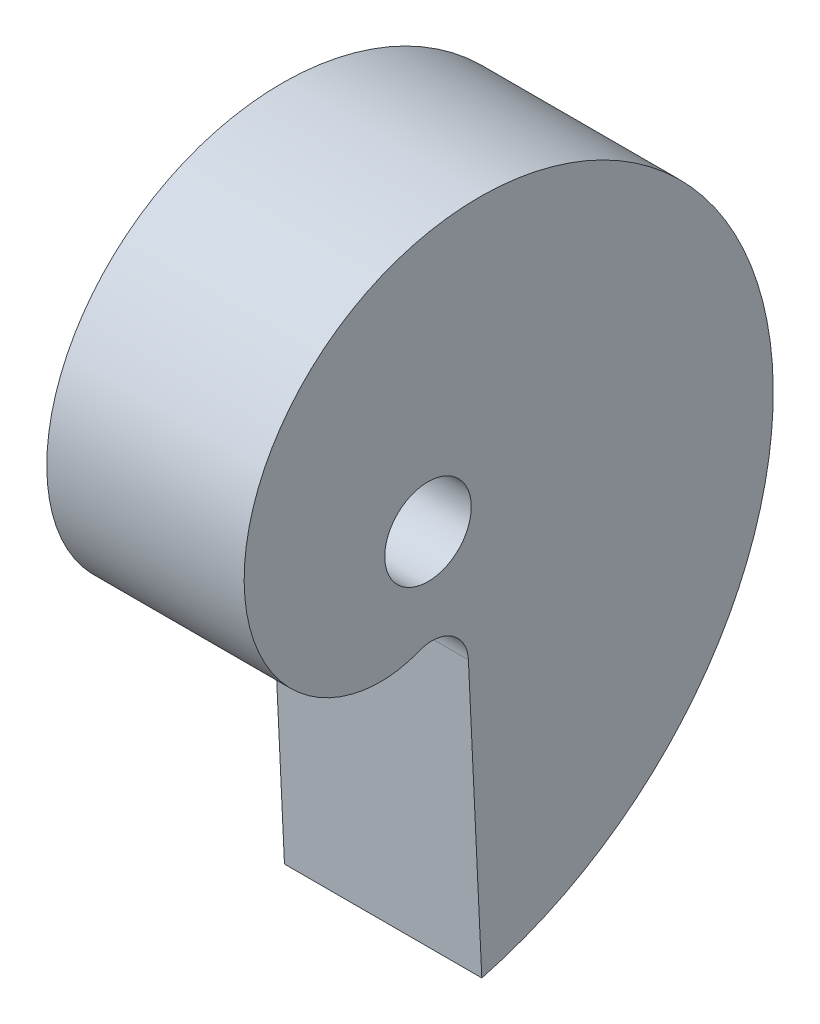
from build123d import *

# Parameters (mm, degrees)
SKETCH4_R              = 3
BOSS_EXTRUDE1_DEPTH    = 12.7
MOVE_FACE1_OUTLINE_R   = 3
MOVE_FACE1_OUTLINE_R_2 = 2.7841
MOVE_FACE1_DEPTH       = 12.7


# Read off the part's stored shape, not the designer's step: Move Face1
with BuildPart() as part:
    # Sketch4 → Boss-Extrude1 (new body)
    with BuildSketch(Plane(origin=(0, 0, 0), x_dir=(0, 0, -1), z_dir=(1, 0, 0))):
        with BuildLine():
            Line((3.667013126, -26.3254835), (2.816473307, -8.431236894))
            ThreePointArc((2.816473307, -8.431236894), (1.639602622, -6.396649217), (-0.700777066, -6.179406175))
            add(Edge.make_bspline(
                [(-0.700777066, -6.179406175), (-1.525102008, -6.512822326), (-2.494871997, -6.679047096), (-4.555429578, -6.54165034), (-5.644996058, -6.237076936), (-7.717261628, -5.106975392), (-8.698405735, -4.281093265), (-10.311829803, -2.164612563), (-10.942499326, -0.874358563), (-11.647480976, 2.006859472), (-11.720427957, 3.596803483), (-11.182779689, 6.826310345), (-10.571334953, 8.46432492), (-9.132019695, 10.73433891), (-8.566197708, 11.459621106), (-7.273120414, 12.810057002), (-6.545872807, 13.435152517), (-4.948692799, 14.549748502), (-4.078780417, 15.039192621), (-2.22269385, 15.85074605), (-1.236551533, 16.172803424), (0.818678144, 16.623204755), (1.887722789, 16.751503646), (4.069669804, 16.79483508), (5.182520117, 16.709831654), (7.408648574, 16.315055224), (8.521867273, 16.00525724), (10.70264063, 15.158359498), (11.770130786, 14.621247223), (13.812561896, 13.326727542), (14.787435905, 12.56932106), (16.598938448, 10.850935673), (17.435500393, 9.889971566), (18.927885533, 7.790674993), (19.583645356, 6.652371052), (20.677096627, 4.233429246), (21.114730733, 2.952832896), (21.741586229, 0.292117033), (21.930758945, -1.087949282), (22.038932986, -3.898444365), (21.957896657, -5.328810088), (21.513783431, -8.186144708), (21.150681858, -9.613043017), (20.141400668, -12.407098951), (19.49521083, -13.774181132), (17.930076055, -16.391877744), (17.011136269, -17.642414844), (14.922264044, -19.972214517), (13.752352434, -21.051401006), (11.194349378, -22.98792657), (9.80629411, -23.845193985), (6.855009859, -25.29377098), (5.291831431, -25.88501641), (3.667013126, -26.3254835)],
                knots=[0, 0, 0, 0, 0.0625, 0.0625, 0.125, 0.125, 0.1875, 0.1875, 0.25, 0.25, 0.3125, 0.3125, 0.375, 0.375, 0.40625, 0.40625, 0.4375, 0.4375, 0.46875, 0.46875, 0.5, 0.5, 0.53125, 0.53125, 0.5625, 0.5625, 0.59375, 0.59375, 0.625, 0.625, 0.65625, 0.65625, 0.6875, 0.6875, 0.71875, 0.71875, 0.75, 0.75, 0.78125, 0.78125, 0.8125, 0.8125, 0.84375, 0.84375, 0.875, 0.875, 0.90625, 0.90625, 0.9375, 0.9375, 0.96875, 0.96875, 1, 1, 1, 1], degree=3))
        make_face()
        Circle(SKETCH4_R, mode=Mode.SUBTRACT)
    extrude(amount=BOSS_EXTRUDE1_DEPTH)

    # Move Face1 outline → Move Face1 (add)
    # profile 1 of 2: a face of its own
    with BuildSketch(Plane.YZ):
        with BuildLine():
            Line((-8.441487365, -2.600816779), (-26.604178645, -3.464116168))
            add(Edge.make_bspline(
                [(-26.604178645, -3.464116168), (-26.599569003, -3.481120458), (-26.594959362, -3.498124748), (-26.59034972, -3.515129038), (-26.585740078, -3.532133328), (-26.581130437, -3.549137618), (-26.576520795, -3.566141908), (-26.571911153, -3.583146198), (-26.567301512, -3.600150488), (-26.56269187, -3.617154778), (-26.558082228, -3.634159068), (-26.553472587, -3.651163358), (-26.548862945, -3.668167648), (-26.544253303, -3.685171938), (-26.53927128, -3.703549889), (-26.538898899, -3.704923549), (-26.538526517, -3.70629721), (-26.538154136, -3.707670871), (-26.537781754, -3.709044531), (-26.537409373, -3.710418192), (-26.537036991, -3.711791852), (-26.53666461, -3.713165513), (-26.536292228, -3.714539173), (-26.535919847, -3.715912834), (-26.535547465, -3.717286495), (-26.535175084, -3.718660155), (-26.534802702, -3.720033816), (-26.53424413, -3.722094307), (-26.534059907, -3.722773916), (-26.533858021, -3.723518442), (-26.533727067, -3.724001851), (-26.533440048, -3.725060798), (-26.533340537, -3.725426825), (-26.533133021, -3.726192717), (-26.532893488, -3.727076218), (-26.532782162, -3.727485594), (-26.532537582, -3.728388165), (-26.532375797, -3.728983938), (-26.532180677, -3.729703197), (-26.531993743, -3.730392017), (-26.531617908, -3.731776793), (-26.531429971, -3.732469173), (-26.531242014, -3.733161545), (-26.531054038, -3.733853909), (-26.530866042, -3.734546265), (-26.530678027, -3.735238614), (-26.530489992, -3.735930954), (-26.530301938, -3.736623286), (-26.530113864, -3.73731561), (-26.529925771, -3.738007927), (-26.529737659, -3.738700235), (-26.529549527, -3.739392535), (-26.529361375, -3.740084828), (-26.528420519, -3.74354625), (-26.527667523, -3.74631526), (-26.526914215, -3.749084142), (-26.526160594, -3.751852897), (-26.525406663, -3.754621524), (-26.524652417, -3.757390023), (-26.523897864, -3.760158394), (-26.523142994, -3.762926638), (-26.522387816, -3.765694753), (-26.521632324, -3.768462741), (-26.520876522, -3.7712306), (-26.520120408, -3.773998332), (-26.519363982, -3.776765936), (-26.517093769, -3.785068362), (-26.515579047, -3.790602801), (-26.514063078, -3.796136728), (-26.512545864, -3.801670141), (-26.511027403, -3.807203041), (-26.509507697, -3.812735429), (-26.507986745, -3.818267302), (-26.506464548, -3.823798661), (-26.504941106, -3.829329506), (-26.503416418, -3.834859837), (-26.501890486, -3.840389653), (-26.500363309, -3.845918954), (-26.498834888, -3.85144774), (-26.494245891, -3.868032549), (-26.491181583, -3.879087027), (-26.488112299, -3.890139439), (-26.485038042, -3.901189785), (-26.481958812, -3.912238061), (-26.478874612, -3.923284266), (-26.475785441, -3.934328398), (-26.472691304, -3.945370453), (-26.4695922, -3.956410431), (-26.466488131, -3.967448328), (-26.463379099, -3.978484142), (-26.460265106, -3.989517871), (-26.457146153, -4.000549514), (-26.441526593, -4.055697279), (-26.428951609, -4.099782062), (-26.416297387, -4.143833272), (-26.403564026, -4.187850766), (-26.390751622, -4.2318344), (-26.377860278, -4.275784033), (-26.364890086, -4.31969952), (-26.351841151, -4.363580717), (-26.338713566, -4.407427483), (-26.325507433, -4.451239673), (-26.312222848, -4.495017144), (-26.298859911, -4.538759754), (-26.285418719, -4.582467358), (-26.217821979, -4.800829638), (-26.162494118, -4.974957082), (-26.105922065, -5.148512984), (-26.048112096, -5.321488181), (-25.989070491, -5.49387351), (-25.928803524, -5.665659807), (-25.867317478, -5.836837911), (-25.804618624, -6.007398657), (-25.740713246, -6.177332884), (-25.675607616, -6.346631428), (-25.609308015, -6.515285126), (-25.541820718, -6.683284815), (-25.473152005, -6.850621333), (-25.263620445, -7.350613883), (-25.119234857, -7.681244245), (-24.970181526, -8.009184855), (-24.816563128, -8.334008567), (-24.658405438, -8.656540908), (-24.495574442, -8.975326705), (-24.328540305, -9.291435032), (-24.157090549, -9.604622916), (-23.981161893, -9.914157206), (-23.801250109, -10.220890306), (-23.616969066, -10.524098117), (-23.428657045, -10.824036045), (-23.23626742, -11.120542818), (-22.843508974, -11.706612059), (-22.643142176, -11.996174333), (-22.438808393, -12.282198027), (-22.230723583, -12.56460565), (-22.018648797, -12.843459923), (-21.802917467, -13.118447754), (-21.583605212, -13.389644606), (-21.360601243, -13.657176078), (-21.134077845, -13.920797741), (-20.904199437, -14.180403567), (-20.670850853, -14.43621903), (-20.434249131, -14.687936687), (-20.194399706, -14.935644556), (-19.70838235, -15.42287054), (-19.462215458, -15.662397811), (-19.212931723, -15.897766285), (-18.960728671, -16.128991264), (-18.70539447, -16.355994955), (-18.447304202, -16.578625492), (-18.186499944, -16.796967202), (-17.922857209, -17.011060359), (-17.656599224, -17.220738444), (-17.387896766, -17.42596103), (-17.116588056, -17.626860373), (-16.842954408, -17.82323191), (-16.566974945, -18.015139117), (-16.010532784, -18.389907039), (-15.730066911, -18.572777232), (-15.447424653, -18.751061226), (-15.162746667, -18.924851219), (-14.875916093, -19.093949929), (-14.587276398, -19.258367365), (-14.296840097, -19.418183126), (-14.004513923, -19.573354608), (-13.710535007, -19.723805382), (-13.415054471, -19.869556513), (-13.117916757, -20.010637113), (-12.819417073, -20.146961011), (-12.519527346, -20.278558541), (-11.917189037, -20.532242336), (-11.614733643, -20.65433651), (-11.311086848, -20.771622769), (-11.006314451, -20.884236095), (-10.700430715, -20.991914806), (-10.39369458, -21.094796517), (-10.086097937, -21.192946197), (-9.777608438, -21.286263743), (-9.468444303, -21.374756831), (-9.158720169, -21.458492374), (-8.848328151, -21.537414262), (-8.537533287, -21.611545146), (-8.226317575, -21.68088471), (-7.603260387, -21.809981168), (-7.291409675, -21.869743076), (-6.979352707, -21.924681004), (-6.667077965, -21.974937355), (-6.354741362, -22.020247701), (-6.042483137, -22.060828702), (-5.730286129, -22.096726163), (-5.418195248, -22.127815836), (-5.10638259, -22.154172495), (-4.794917194, -22.175889882), (-4.483768614, -22.19285834), (-4.173135796, -22.205184806), (-3.863025065, -22.212847752), (-3.244042, -22.218898546), (-2.935160635, -22.217283683), (-2.627009812, -22.211051294), (-2.319535889, -22.200221076), (-2.012978585, -22.184764162), (-1.707390049, -22.164745089), (-1.402745405, -22.140231054), (-1.099140461, -22.111224435), (-0.796711927, -22.077727229), (-0.495491172, -22.03980106), (-0.195495425, -21.997498698), (0.103120125, -21.950796576), (0.400341286, -21.899765548), (0.991819558, -21.789077387), (1.28608355, -21.729419077), (1.578768432, -21.665496674), (1.869917455, -21.597302553), (2.159298453, -21.524877058), (2.446882891, -21.44828864), (2.732707168, -21.367584679), (3.016672969, -21.282790594), (3.298648908, -21.193943649), (3.578623787, -21.101102717), (3.85659217, -21.004314712), (4.132391722, -20.903599993), (4.406031128, -20.799020335), (4.948821205, -20.582201458), (5.217977174, -20.469959264), (5.484813738, -20.353954278), (5.749350964, -20.234161295), (6.01138819, -20.110681465), (6.270917632, -19.983580155), (6.527976619, -19.852885482), (6.782472092, -19.718646938), (7.034289441, -19.580933449), (7.283432367, -19.43979613), (7.529901875, -19.295274808), (7.77354503, -19.147434253), (8.014385292, -18.996321733), (8.490309508, -18.687660003), (8.725396651, -18.530106846), (8.957555599, -18.369412167), (9.186776625, -18.205547192), (9.412909718, -18.038656901), (9.635962414, -17.868799381), (9.855964095, -17.695988596), (10.072835585, -17.520295455), (10.286488685, -17.341812823), (10.496935081, -17.160582706), (10.704177349, -16.976639307), (10.908088748, -16.790084702), (11.108697582, -16.60095136), (11.503188846, -16.217665056), (11.697072069, -16.023508272), (11.887567215, -15.826919792), (12.074634411, -15.627883555), (12.258185431, -15.42656542), (12.438237852, -15.223014525), (12.614807781, -15.017239038), (12.787836646, -14.809325702), (12.957268738, -14.599380603), (13.123118176, -14.387438261), (13.285386007, -14.173530705), (13.443983714, -13.9577844), (13.598936774, -13.740220791), (13.901469825, -13.301617581), (14.049048428, -13.080575457), (14.192938252, -12.85786673), (14.333075884, -12.633504041), (14.469436513, -12.407648424), (14.602043246, -12.180340569), (14.730898025, -11.951592848), (14.855967044, -11.721500116), (14.977228845, -11.490169384), (15.094696526, -11.257631481), (15.208368824, -11.023920803), (15.318201343, -10.789171515), (15.424212302, -10.553400689), (15.62854924, -10.079983096), (15.726872378, -9.842336108), (15.821368333, -9.603809457), (15.911963677, -9.364456828), (15.998688398, -9.124410274), (16.081568069, -8.883704025), (16.160594519, -8.642364015), (16.235759672, -8.400484565), (16.307073362, -8.15816166), (16.374546973, -7.915427103), (16.438178826, -7.672322007), (16.497967314, -7.428970727), (16.553923089, -7.185393613), (16.658169192, -6.697950384), (16.706458163, -6.454088263), (16.750931294, -6.210116308), (16.791551227, -5.966156004), (16.828352164, -5.722265003), (16.861371473, -5.478483856), (16.89061727, -5.234873215), (16.916091026, -4.991505669), (16.937812625, -4.748444975), (16.955811803, -4.505744551), (16.970101403, -4.263463823), (16.98068149, -4.021672476), (16.987586075, -3.780425869), (16.994060031, -3.299148156), (16.993631026, -3.059123221), (16.989555385, -2.819737011), (16.981828074, -2.581119041), (16.97049256, -2.343310945), (16.955590155, -2.106340667), (16.937140606, -1.870268338), (16.91516095, -1.635166239), (16.889682937, -1.401088709), (16.860744509, -1.168076804), (16.828369507, -0.936186685), (16.792572797, -0.705489655), (16.753396921, -0.476025059), (16.668327332, -0.019684131), (16.622436928, 0.207187985), (16.573210516, 0.43274012), (16.520676595, 0.656845924), (16.464882551, 0.879479604), (16.405870334, 1.100624284), (16.3436718, 1.320223268), (16.278319602, 1.538208936), (16.209854217, 1.754538123), (16.138317988, 1.969182142), (16.063745228, 2.182090339), (15.986166539, 2.393194111), (15.905627626, 2.602469813), (15.738694717, 3.017250287), (15.652304686, 3.222753348), (15.563011722, 3.426348397), (15.470874943, 3.627923175), (15.375941264, 3.827466031), (15.27825116, 4.024968988), (15.177848129, 4.22038201), (15.074779017, 4.413646484), (14.969089842, 4.604731213), (14.860824208, 4.793618869), (14.750025822, 4.980266585), (14.6367404, 5.164613119), (14.521012434, 5.346648599), (14.284759964, 5.705997611), (14.164238936, 5.88331198), (14.041346931, 6.058244698), (13.916166576, 6.230707349), (13.788741729, 6.400699169), (13.659110682, 6.568218603), (13.527326668, 6.733225876), (13.393447683, 6.895675454), (13.257522548, 7.055547765), (13.11959423, 7.212834846), (12.979713874, 7.367503996), (12.837939646, 7.519506253), (12.694312503, 7.668841812), (12.403459758, 7.962101433), (12.256236093, 8.106028416), (12.107245062, 8.247230378), (11.956582639, 8.385649016), (11.804288588, 8.521291455), (11.65039943, 8.654160681), (11.494975113, 8.78422985), (11.338080513, 8.911469301), (11.179764974, 9.035870418), (11.020069941, 9.157432821), (10.859051406, 9.276135657), (10.696775757, 9.391945779), (10.53327979, 9.504870215), (10.348041361, 9.62863484), (10.327440973, 9.642341074), (10.306822731, 9.656001739), (10.286186731, 9.669616814), (10.265532905, 9.683186339), (10.244861188, 9.696710349), (10.224171615, 9.710188832), (10.203464367, 9.723621723), (10.182739741, 9.737008906), (10.161998068, 9.750350261), (10.141239561, 9.763645725), (10.12046411, 9.776895389), (10.099671, 9.79009961), (10.058046161, 9.81641871), (10.037217098, 9.829531834), (10.016371494, 9.842598537), (9.995509453, 9.855618821), (9.974631077, 9.868592692), (9.953736471, 9.881520152), (9.932825737, 9.894401206), (9.911898978, 9.907235857), (9.890956298, 9.920024109), (9.869997801, 9.932765967), (9.849023589, 9.945461434), (9.828033765, 9.958110514), (9.807028434, 9.97071321), (9.743966224, 10.00838216), (9.701863133, 10.033309276), (9.659699249, 10.058050905), (9.617475395, 10.082607077), (9.575192397, 10.106977826), (9.532851077, 10.131163181), (9.490452261, 10.155163174), (9.447996771, 10.178977836), (9.405485434, 10.202607198), (9.362919072, 10.226051291), (9.320298511, 10.249310147), (9.277624573, 10.272383796), (9.234898083, 10.29527227), (9.106563432, 10.363382261), (9.020800116, 10.408048353), (8.934836483, 10.451974125), (8.848679096, 10.495159823), (8.762334519, 10.537605698), (8.675809318, 10.579311995), (8.589110055, 10.620278965), (8.502243296, 10.660506853), (8.415215603, 10.699995909), (8.328033542, 10.73874638), (8.240703676, 10.776758515), (8.15323257, 10.814032561), (8.065626787, 10.850568766), (7.802425101, 10.957964605), (7.626444742, 11.026611369), (7.450004147, 11.092309662), (7.27315561, 11.155061426), (7.095951384, 11.214868552), (6.918443686, 11.271732888), (6.740684687, 11.325656229), (6.562726523, 11.376640328), (6.384621288, 11.424686885), (6.206421038, 11.469797554), (6.028177787, 11.511973941), (5.84994351, 11.551217606), (5.671770144, 11.587530057), (5.315649022, 11.654295458), (5.137728602, 11.684747226), (4.959700016, 11.712299475), (4.783019884, 11.736712222), (4.604276011, 11.758891306), (4.429464411, 11.777036031), (4.250811556, 11.793890793), (4.076436597, 11.806370641), (3.899761626, 11.817263639), (3.725133165, 11.824666119), (3.550410334, 11.829638498), (3.37648165, 11.831780195), (3.203155326, 11.831236863), (2.857881444, 11.824777298), (2.685930065, 11.818863209), (2.51470827, 11.810286856), (2.344260063, 11.799070213), (2.174629427, 11.785235191), (2.005860324, 11.768803637), (1.837996698, 11.749797331), (1.671082472, 11.728237989), (1.50516155, 11.704147262), (1.340277816, 11.677546737), (1.176475132, 11.648457935), (1.013797343, 11.616902313), (0.852288272, 11.582901263), (0.61184345, 11.528263534), (0.53200571, 11.509447542), (0.452431498, 11.490014724), (0.373262519, 11.470000825), (0.294382178, 11.449393041), (0.215797381, 11.428191413), (0.137577788, 11.406409742), (0.059709652, 11.384053465), (-0.017850954, 11.361120913), (-0.095072103, 11.33761765), (-0.171912733, 11.313553202), (-0.248433789, 11.288926884), (-0.324588602, 11.263745774), (-0.476187787, 11.21228181), (-0.551629997, 11.185999058), (-0.626711201, 11.159170067), (-0.701427774, 11.131799368), (-0.775776089, 11.103891494), (-0.849752523, 11.075450975), (-0.92335345, 11.046482344), (-0.996575245, 11.016990131), (-1.069414282, 10.986978867), (-1.141866938, 10.956453085), (-1.213929586, 10.925417316), (-1.285598602, 10.89387609), (-1.35687036, 10.86183394), (-1.569482988, 10.764218312), (-1.709621229, 10.697155476), (-1.848127108, 10.628143005), (-1.98497177, 10.557216936), (-2.120126347, 10.484413233), (-2.253561967, 10.409767786), (-2.385249746, 10.333316406), (-2.515160795, 10.255094835), (-2.643266216, 10.175138734), (-2.769537102, 10.093483694), (-2.893944539, 10.010165228), (-3.016459604, 9.925218776), (-3.137053367, 9.838679702), (-3.315018649, 9.706535092), (-3.373849905, 9.662101445), (-3.432225085, 9.617246491), (-3.489973308, 9.572127532), (-3.547384771, 9.52651408), (-3.604222119, 9.480589049), (-3.660493818, 9.43435795), (-3.716362737, 9.387700649), (-3.771715305, 9.340702599), (-3.826473613, 9.293429538), (-3.880830859, 9.245743042), (-3.934616774, 9.197770987), (-3.987913252, 9.149459099), (-4.093478067, 9.052199488), (-4.145749357, 9.003249721), (-4.19750826, 8.953985292), (-4.248753506, 8.904411497), (-4.299483825, 8.854533635), (-4.349697947, 8.804357003), (-4.399394603, 8.753886901), (-4.448572522, 8.703128624), (-4.497230434, 8.652087473), (-4.545367069, 8.600768744), (-4.592981158, 8.549177736), (-4.640071431, 8.497319746), (-4.686636617, 8.445200073), (-4.824753105, 8.288071896), (-4.914725275, 8.182294046), (-5.002581891, 8.075532644), (-5.088312844, 7.967829797), (-5.171907984, 7.859227538), (-5.253357116, 7.749767825), (-5.332650002, 7.639492543), (-5.409776362, 7.528443501), (-5.48472587, 7.416662437), (-5.55748816, 7.304191013), (-5.628052821, 7.191070818), (-5.696409398, 7.077343365), (-5.762547394, 6.963050096), (-5.890365144, 6.733414655), (-5.952053709, 6.61804774), (-6.011379226, 6.5024593), (-6.068789532, 6.385932229), (-6.123482319, 6.2698429), (-6.176476599, 6.152615371), (-6.226996856, 6.035513752), (-6.275228474, 5.918322644), (-6.321621575, 5.800380212), (-6.365473581, 5.682832438), (-6.407390636, 5.564799764), (-6.447052072, 5.446825396), (-6.484587524, 5.328765169), (-6.55536853, 5.092635858), (-6.588616961, 4.974562342), (-6.619731944, 4.856519728), (-6.64872202, 4.73854772), (-6.675595644, 4.620685966), (-6.700361191, 4.50297406), (-6.723026952, 4.385451536), (-6.743601132, 4.268157874), (-6.762091856, 4.151132495), (-6.778507164, 4.034414767), (-6.792855012, 3.918043998), (-6.805143275, 3.802059442), (-6.815379741, 3.686500296), (-6.839956872, 3.341216503), (-6.848154204, 3.113073347), (-6.848438469, 2.887099769), (-6.84084938, 2.663718746), (-6.825763132, 2.443005573), (-6.803253008, 2.225285636), (-6.773501282, 2.01082461), (-6.73678547, 1.799796855), (-6.69324338, 1.592468222), (-6.643018498, 1.389115017), (-6.586393416, 1.18991247), (-6.52346955, 0.995146747), (-6.454467342, 0.805035191), (-6.379554183, 0.619822851)],
                knots=[-0.001662915, -0.001662915, -0.001662915, -0.001662915, -0.001662915, -0.001662915, -0.001662915, -0.001662915, -0.001662915, -0.001662915, -0.001662915, -0.001662915, -0.001662915, -0.001662915, -0.001662915, -0.000136719, -0.000136719, -0.000136719, -0.000136719, -0.000136719, -0.000136719, -0.000136719, -0.000136719, -0.000136719, -0.000136719, -0.000136719, -0.000136719, -0.000136719, -1.3428e-05, -1.3428e-05, -1.3428e-05, -1.3428e-05, -1.3428e-05, -1.3428e-05, -1.3428e-05, -1.3428e-05, -1.3428e-05, -1.3428e-05, -1.3428e-05, -1.3428e-05, -1.3428e-05, 4.8218e-05, 4.8218e-05, 4.8218e-05, 4.8218e-05, 4.8218e-05, 4.8218e-05, 4.8218e-05, 4.8218e-05, 4.8218e-05, 4.8218e-05, 4.8218e-05, 4.8218e-05, 4.8218e-05, 0.000109863, 0.000109863, 0.000109863, 0.000109863, 0.000109863, 0.000109863, 0.000109863, 0.000109863, 0.000109863, 0.000109863, 0.000109863, 0.000109863, 0.000109863, 0.000356445, 0.000356445, 0.000356445, 0.000356445, 0.000356445, 0.000356445, 0.000356445, 0.000356445, 0.000356445, 0.000356445, 0.000356445, 0.000356445, 0.000356445, 0.000849609, 0.000849609, 0.000849609, 0.000849609, 0.000849609, 0.000849609, 0.000849609, 0.000849609, 0.000849609, 0.000849609, 0.000849609, 0.000849609, 0.000849609, 0.001835937, 0.001835937, 0.001835937, 0.001835937, 0.001835937, 0.001835937, 0.001835937, 0.001835937, 0.001835937, 0.001835937, 0.001835937, 0.001835937, 0.001835937, 0.00578125, 0.00578125, 0.00578125, 0.00578125, 0.00578125, 0.00578125, 0.00578125, 0.00578125, 0.00578125, 0.00578125, 0.00578125, 0.00578125, 0.00578125, 0.0215625, 0.0215625, 0.0215625, 0.0215625, 0.0215625, 0.0215625, 0.0215625, 0.0215625, 0.0215625, 0.0215625, 0.0215625, 0.0215625, 0.0215625, 0.053125, 0.053125, 0.053125, 0.053125, 0.053125, 0.053125, 0.053125, 0.053125, 0.053125, 0.053125, 0.053125, 0.053125, 0.053125, 0.0846875, 0.0846875, 0.0846875, 0.0846875, 0.0846875, 0.0846875, 0.0846875, 0.0846875, 0.0846875, 0.0846875, 0.0846875, 0.0846875, 0.0846875, 0.11625, 0.11625, 0.11625, 0.11625, 0.11625, 0.11625, 0.11625, 0.11625, 0.11625, 0.11625, 0.11625, 0.11625, 0.11625, 0.1478125, 0.1478125, 0.1478125, 0.1478125, 0.1478125, 0.1478125, 0.1478125, 0.1478125, 0.1478125, 0.1478125, 0.1478125, 0.1478125, 0.1478125, 0.179375, 0.179375, 0.179375, 0.179375, 0.179375, 0.179375, 0.179375, 0.179375, 0.179375, 0.179375, 0.179375, 0.179375, 0.179375, 0.2109375, 0.2109375, 0.2109375, 0.2109375, 0.2109375, 0.2109375, 0.2109375, 0.2109375, 0.2109375, 0.2109375, 0.2109375, 0.2109375, 0.2109375, 0.2425, 0.2425, 0.2425, 0.2425, 0.2425, 0.2425, 0.2425, 0.2425, 0.2425, 0.2425, 0.2425, 0.2425, 0.2425, 0.2740625, 0.2740625, 0.2740625, 0.2740625, 0.2740625, 0.2740625, 0.2740625, 0.2740625, 0.2740625, 0.2740625, 0.2740625, 0.2740625, 0.2740625, 0.305625, 0.305625, 0.305625, 0.305625, 0.305625, 0.305625, 0.305625, 0.305625, 0.305625, 0.305625, 0.305625, 0.305625, 0.305625, 0.3371875, 0.3371875, 0.3371875, 0.3371875, 0.3371875, 0.3371875, 0.3371875, 0.3371875, 0.3371875, 0.3371875, 0.3371875, 0.3371875, 0.3371875, 0.36875, 0.36875, 0.36875, 0.36875, 0.36875, 0.36875, 0.36875, 0.36875, 0.36875, 0.36875, 0.36875, 0.36875, 0.36875, 0.4003125, 0.4003125, 0.4003125, 0.4003125, 0.4003125, 0.4003125, 0.4003125, 0.4003125, 0.4003125, 0.4003125, 0.4003125, 0.4003125, 0.4003125, 0.431875, 0.431875, 0.431875, 0.431875, 0.431875, 0.431875, 0.431875, 0.431875, 0.431875, 0.431875, 0.431875, 0.431875, 0.431875, 0.4634375, 0.4634375, 0.4634375, 0.4634375, 0.4634375, 0.4634375, 0.4634375, 0.4634375, 0.4634375, 0.4634375, 0.4634375, 0.4634375, 0.4634375, 0.495, 0.495, 0.495, 0.495, 0.495, 0.495, 0.495, 0.495, 0.495, 0.495, 0.495, 0.495, 0.495, 0.5265625, 0.5265625, 0.5265625, 0.5265625, 0.5265625, 0.5265625, 0.5265625, 0.5265625, 0.5265625, 0.5265625, 0.5265625, 0.5265625, 0.5265625, 0.558125, 0.558125, 0.558125, 0.558125, 0.558125, 0.558125, 0.558125, 0.558125, 0.558125, 0.558125, 0.558125, 0.558125, 0.558125, 0.5896875, 0.5896875, 0.5896875, 0.5896875, 0.5896875, 0.5896875, 0.5896875, 0.5896875, 0.5896875, 0.5896875, 0.5896875, 0.5896875, 0.5896875, 0.62125, 0.62125, 0.62125, 0.62125, 0.62125, 0.62125, 0.62125, 0.62125, 0.62125, 0.62125, 0.62125, 0.62125, 0.62125, 0.625195313, 0.625195313, 0.625195313, 0.625195313, 0.625195313, 0.625195313, 0.625195313, 0.625195313, 0.625195313, 0.625195313, 0.625195313, 0.625195313, 0.625195313, 0.629140625, 0.629140625, 0.629140625, 0.629140625, 0.629140625, 0.629140625, 0.629140625, 0.629140625, 0.629140625, 0.629140625, 0.629140625, 0.629140625, 0.629140625, 0.63703125, 0.63703125, 0.63703125, 0.63703125, 0.63703125, 0.63703125, 0.63703125, 0.63703125, 0.63703125, 0.63703125, 0.63703125, 0.63703125, 0.63703125, 0.6528125, 0.6528125, 0.6528125, 0.6528125, 0.6528125, 0.6528125, 0.6528125, 0.6528125, 0.6528125, 0.6528125, 0.6528125, 0.6528125, 0.6528125, 0.684375, 0.684375, 0.684375, 0.684375, 0.684375, 0.684375, 0.684375, 0.684375, 0.684375, 0.684375, 0.684375, 0.684375, 0.684375, 0.7159375, 0.7159375, 0.7159375, 0.7159375, 0.7159375, 0.7159375, 0.7159375, 0.7159375, 0.7159375, 0.7159375, 0.7159375, 0.7159375, 0.7159375, 0.7475, 0.7475, 0.7475, 0.7475, 0.7475, 0.7475, 0.7475, 0.7475, 0.7475, 0.7475, 0.7475, 0.7475, 0.7475, 0.76328125, 0.76328125, 0.76328125, 0.76328125, 0.76328125, 0.76328125, 0.76328125, 0.76328125, 0.76328125, 0.76328125, 0.76328125, 0.76328125, 0.76328125, 0.7790625, 0.7790625, 0.7790625, 0.7790625, 0.7790625, 0.7790625, 0.7790625, 0.7790625, 0.7790625, 0.7790625, 0.7790625, 0.7790625, 0.7790625, 0.810625, 0.810625, 0.810625, 0.810625, 0.810625, 0.810625, 0.810625, 0.810625, 0.810625, 0.810625, 0.810625, 0.810625, 0.810625, 0.82640625, 0.82640625, 0.82640625, 0.82640625, 0.82640625, 0.82640625, 0.82640625, 0.82640625, 0.82640625, 0.82640625, 0.82640625, 0.82640625, 0.82640625, 0.8421875, 0.8421875, 0.8421875, 0.8421875, 0.8421875, 0.8421875, 0.8421875, 0.8421875, 0.8421875, 0.8421875, 0.8421875, 0.8421875, 0.8421875, 0.87375, 0.87375, 0.87375, 0.87375, 0.87375, 0.87375, 0.87375, 0.87375, 0.87375, 0.87375, 0.87375, 0.87375, 0.87375, 0.9053125, 0.9053125, 0.9053125, 0.9053125, 0.9053125, 0.9053125, 0.9053125, 0.9053125, 0.9053125, 0.9053125, 0.9053125, 0.9053125, 0.9053125, 0.936875, 0.936875, 0.936875, 0.936875, 0.936875, 0.936875, 0.936875, 0.936875, 0.936875, 0.936875, 0.936875, 0.936875, 0.936875, 1, 1, 1, 1, 1, 1, 1, 1, 1, 1, 1, 1, 1, 1, 1], degree=14))
            ThreePointArc((-6.379554183, 0.619822851), (-6.578477057, -1.52319194), (-8.441487365, -2.600816779))
        make_face()
        with BuildLine():
            add(Edge.make_bspline(
                [(-26.3254835, -3.667013126), (-25.88501641, -5.291831431), (-25.29377098, -6.855009859), (-23.845193985, -9.80629411), (-22.98792657, -11.194349378), (-21.051401006, -13.752352434), (-19.972214517, -14.922264044), (-17.642414844, -17.011136269), (-16.391877744, -17.930076055), (-13.774181132, -19.49521083), (-12.407098951, -20.141400668), (-9.613043017, -21.150681858), (-8.186144708, -21.513783431), (-5.328810088, -21.957896657), (-3.898444365, -22.038932986), (-1.087949282, -21.930758945), (0.292117033, -21.741586229), (2.952832896, -21.114730733), (4.233429246, -20.677096627), (6.652371052, -19.583645356), (7.790674993, -18.927885533), (9.889971566, -17.435500393), (10.850935673, -16.598938448), (12.56932106, -14.787435905), (13.326727542, -13.812561896), (14.621247223, -11.770130786), (15.158359498, -10.70264063), (16.00525724, -8.521867273), (16.315055224, -7.408648574), (16.709831654, -5.182520117), (16.79483508, -4.069669804), (16.751503646, -1.887722789), (16.623204755, -0.818678144), (16.172803424, 1.236551533), (15.85074605, 2.22269385), (15.039192621, 4.078780417), (14.549748502, 4.948692799), (13.435152517, 6.545872807), (12.810057002, 7.273120414), (11.459621106, 8.566197708), (10.73433891, 9.132019695), (8.46432492, 10.571334953), (6.826310345, 11.182779689), (3.596803483, 11.720427957), (2.006859472, 11.647480976), (-0.874358563, 10.942499326), (-2.164612563, 10.311829803), (-4.281093265, 8.698405735), (-5.106975392, 7.717261628), (-6.237076936, 5.644996058), (-6.54165034, 4.555429578), (-6.679047096, 2.494871997), (-6.512822326, 1.525102008), (-6.179406175, 0.700777066)],
                knots=[0, 0, 0, 0, 0.03125, 0.03125, 0.0625, 0.0625, 0.09375, 0.09375, 0.125, 0.125, 0.15625, 0.15625, 0.1875, 0.1875, 0.21875, 0.21875, 0.25, 0.25, 0.28125, 0.28125, 0.3125, 0.3125, 0.34375, 0.34375, 0.375, 0.375, 0.40625, 0.40625, 0.4375, 0.4375, 0.46875, 0.46875, 0.5, 0.5, 0.53125, 0.53125, 0.5625, 0.5625, 0.59375, 0.59375, 0.625, 0.625, 0.6875, 0.6875, 0.75, 0.75, 0.8125, 0.8125, 0.875, 0.875, 0.9375, 0.9375, 1, 1, 1, 1], degree=3))
            Line((-26.3254835, -3.667013126), (-8.431236894, -2.816473307))
            ThreePointArc((-8.431236894, -2.816473307), (-6.396649217, -1.639602622), (-6.179406175, 0.700777066))
        make_face(mode=Mode.SUBTRACT)
    # profile 2 of 2: a face of its own
    with BuildSketch(Plane.YZ):
        Circle(MOVE_FACE1_OUTLINE_R)
        Circle(MOVE_FACE1_OUTLINE_R_2, mode=Mode.SUBTRACT)
    extrude(amount=MOVE_FACE1_DEPTH)


solid = part.part
